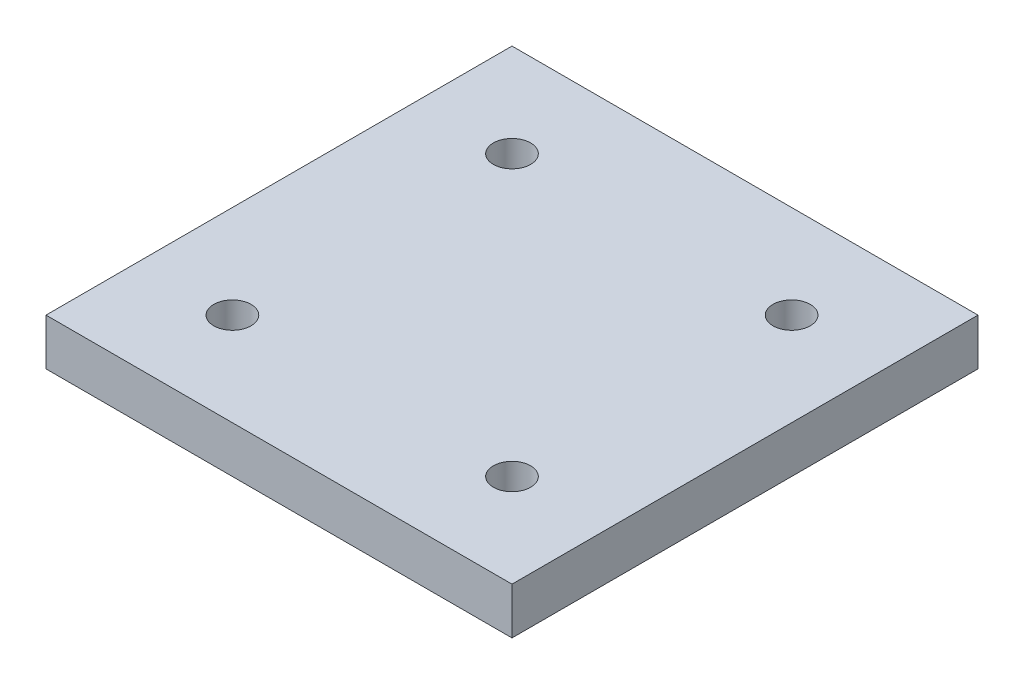
from build123d import *

# Parameters (mm, degrees)
SKETCH_1_W          = 100
SKETCH_1_H          = 100
EXTRUDE_1_DEPTH     = 10
SKETCH_2_R          = 4
CUT_EXTRUDE_1_DEPTH = 72.414284285


with BuildPart() as part:
    # Эскиз1 → Бобышка-Вытянуть1 (new body)
    with BuildSketch(Plane(origin=(0, 0, 0), x_dir=(1, 0, 0), z_dir=(0, 1, 0))):
        Rectangle(SKETCH_1_W, SKETCH_1_H)
    extrude(amount=EXTRUDE_1_DEPTH)

    # Эскиз2 → Вырез-Вытянуть1 (cut, through all)
    with BuildSketch(Plane(origin=(0, 10, 0), x_dir=(1, 0, 0), z_dir=(0, 1, 0))):
        with Locations((-30, 30)):
            Circle(SKETCH_2_R)
        with Locations((30, 30)):
            Circle(SKETCH_2_R)
        with Locations((-30, -30)):
            Circle(SKETCH_2_R)
        with Locations((30, -30)):
            Circle(SKETCH_2_R)
    extrude(amount=-CUT_EXTRUDE_1_DEPTH, mode=Mode.SUBTRACT)


solid = part.part
